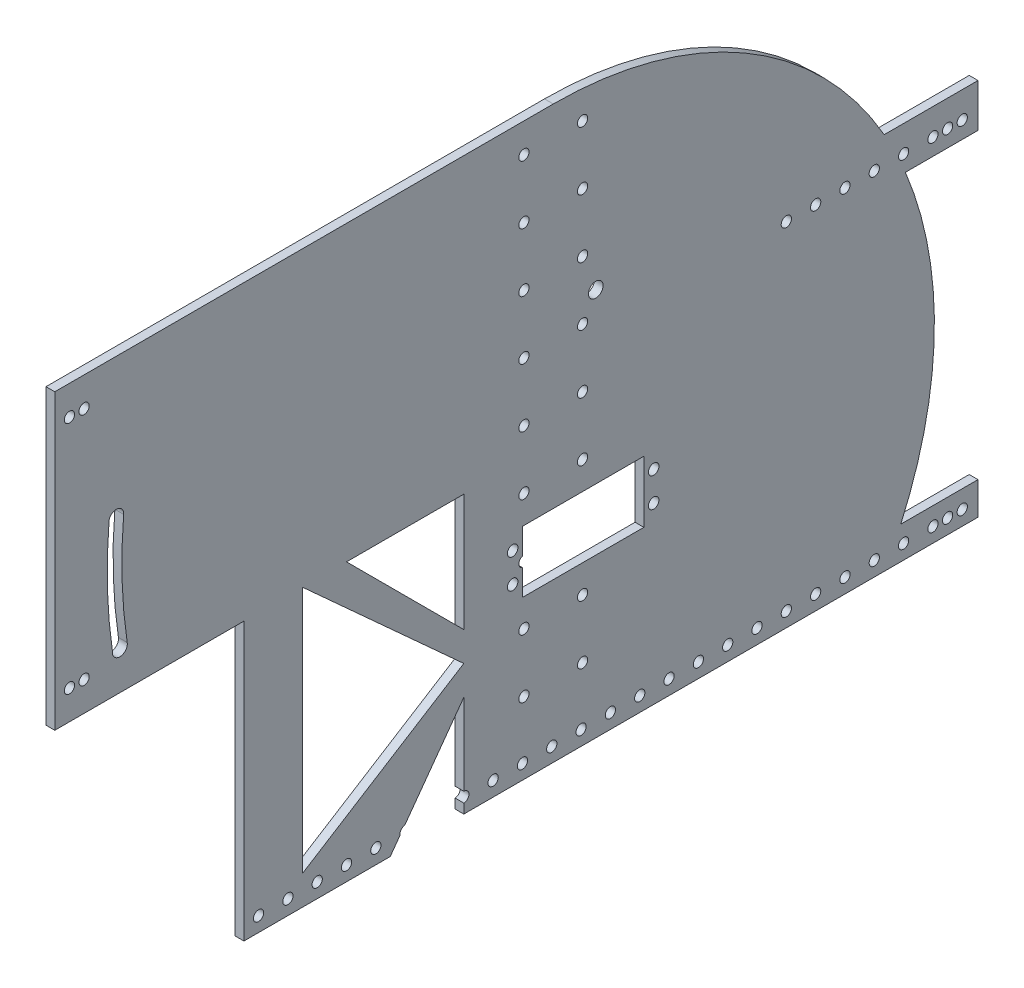
from build123d import *

# Parameters (mm, degrees)
SKETCH1_R           = 5
BOSS_EXTRUDE1_DEPTH = 3
SKETCH2_R           = 1.8
SKETCH2_W           = 41.4
SKETCH2_H           = 21
SERVOHOLE_DEPTH     = 215.030371677
SKETCH3_W           = 322.70302131
SKETCH3_H           = 65.5
CUT_EXTRUDE2_DEPTH  = 215.030371677
SKETCH4_W           = 64.5
SKETCH4_H           = 115
CUT_EXTRUDE5_DEPTH  = 215.030371677
SKETCH5_R           = 1.75
CUT_EXTRUDE6_DEPTH  = 10
LPATTERN1_COUNT     = 14
LPATTERN1_PITCH     = 10
LPATTERN2_COUNT     = 14
LPATTERN2_PITCH     = 10
SKETCH6_R           = 1.75
CUT_EXTRUDE7_DEPTH  = 10
BOSS_EXTRUDE2_START = -3
SKETCH7_R           = 1.75
BOSS_EXTRUDE2_DEPTH = 3
SKETCH8_R           = 2.5
CUT_EXTRUDE8_DEPTH  = 3
SKETCH9_R           = 1.75
CUT_EXTRUDE9_DEPTH  = 10
SKETCH10_R          = 1.75
CUT_EXTRUDE10_DEPTH = 10


with BuildPart() as part:
    # Sketch1 → Boss-Extrude1 (new body)
    with BuildSketch(Plane(origin=(0, 0, 0), x_dir=(0, 0, -1), z_dir=(1, 0, 0))):
        with BuildLine():
            Line((0, 130), (-170, 130))
            Line((-170, 130), (-170, 30))
            Line((-170, 30), (-126.491106407, 30))
            ThreePointArc((-126.491106407, 30), (80.622577483, -101.980390272), (0, 130))
        make_face()
        Circle(SKETCH1_R, mode=Mode.SUBTRACT)
    extrude(amount=BOSS_EXTRUDE1_DEPTH)

    # Sketch2 → ServoHole (cut, through all)
    with BuildSketch(Plane(origin=(3, 0, 0), x_dir=(0, 0, -1), z_dir=(1, 0, 0))):
        with Locations((-13.85, 5)):
            Circle(SKETCH2_R)
        with Locations((-13.85, -5)):
            Circle(SKETCH2_R)
        with Locations((34.25, 5)):
            Circle(SKETCH2_R)
        with Locations((34.25, -5)):
            Circle(SKETCH2_R)
        with Locations((10.2, 0)):
            Rectangle(SKETCH2_W, SKETCH2_H)
    extrude(amount=-SERVOHOLE_DEPTH, mode=Mode.SUBTRACT)

    # Sketch3 → Cut-Extrude2 (cut, through all)
    with BuildSketch(Plane(origin=(3, 0, 0), x_dir=(0, 0, -1), z_dir=(1, 0, 0))):
        with Locations((-37.404207891, -97.25)):
            Rectangle(SKETCH3_W, SKETCH3_H)
    extrude(amount=-CUT_EXTRUDE2_DEPTH, mode=Mode.SUBTRACT)

    # Sketch4 → Cut-Extrude5 (cut, through all)
    with BuildSketch(Plane(origin=(3, 0, 0), x_dir=(0, 0, -1), z_dir=(1, 0, 0))):
        with Locations((-137.75, -27.5)):
            Rectangle(SKETCH4_W, SKETCH4_H)
        Polygon((-30.5, 30), (-30.5, -10), (-70.5, 30), align=None)
        Polygon((-85.5, 30), (-30.5, -20), (-85.5, -54.5), align=None)
        Polygon((-30.5, -30), (-70.5, -85), (-30.5, -85), align=None)
    extrude(amount=-CUT_EXTRUDE5_DEPTH, mode=Mode.SUBTRACT)

    # Sketch5 → Cut-Extrude6 (cut)
    with BuildSketch(Plane(origin=(3, 0, 0), x_dir=(0, 0, -1), z_dir=(1, 0, 0))):
        with Locations((-20.5, -59.5)):
            Circle(SKETCH5_R)
    cut_extrude6 = extrude(amount=-CUT_EXTRUDE6_DEPTH, mode=Mode.SUBTRACT)

    # LPattern1: Cut-Extrude6 ×14
    with Locations(*[(0, 0, -i * LPATTERN1_PITCH) for i in range(1, LPATTERN1_COUNT)]):
        add(cut_extrude6, mode=Mode.SUBTRACT)

    # LPattern2: Cut-Extrude6 ×14
    with Locations(*[(0, 0, i * LPATTERN2_PITCH) for i in range(1, LPATTERN2_COUNT)]):
        add(cut_extrude6, mode=Mode.SUBTRACT)

    # Sketch6 → Cut-Extrude7 (cut)
    with BuildSketch(Plane(origin=(3, 0, 0), x_dir=(0, 0, -1), z_dir=(1, 0, 0))):
        with Locations((109.5, 55.5)):
            Circle(SKETCH6_R)
        with Locations((99.5, 55.5)):
            Circle(SKETCH6_R)
        with Locations((89.5, 55.5)):
            Circle(SKETCH6_R)
        with Locations((79.5, 55.5)):
            Circle(SKETCH6_R)
    extrude(amount=-CUT_EXTRUDE7_DEPTH, mode=Mode.SUBTRACT)

    # Sketch7 → Boss-Extrude2 (add)
    # profile 1 of 2: a face of its own
    with BuildSketch(Plane(origin=(3, 0, 0), x_dir=(0, 0, -1), z_dir=(1, 0, 0)).offset(BOSS_EXTRUDE2_START)):
        with BuildLine():
            Line((112.870501018, -64.5), (144.870501018, -64.5))
            Line((144.870501018, -64.5), (144.870501018, -53.383029617))
            Line((144.870501018, -53.383029617), (118.533759533, -53.383029617))
            ThreePointArc((118.533759533, -53.383029617), (115.835571859, -59.009493238), (112.870501018, -64.5))
        make_face()
        with Locations((119.5, -59.5)):
            Circle(SKETCH7_R, mode=Mode.SUBTRACT)
        with Locations((129.5, -59.5)):
            Circle(SKETCH7_R, mode=Mode.SUBTRACT)
        with Locations((139.5, -59.5)):
            Circle(SKETCH7_R, mode=Mode.SUBTRACT)
        with Locations((134.5, -59.5)):
            Circle(SKETCH7_R, mode=Mode.SUBTRACT)
    # profile 2 of 2: a face of its own
    with BuildSketch(Plane(origin=(3, 0, 0), x_dir=(0, 0, -1), z_dir=(1, 0, 0)).offset(BOSS_EXTRUDE2_START)):
        with BuildLine():
            Line((112.870501018, 64.5), (144.870501018, 64.5))
            Line((144.870501018, 64.5), (144.870501018, 49.754581271))
            Line((144.870501018, 49.754581271), (120.101963525, 49.754581271))
            ThreePointArc((120.101963525, 49.754581271), (116.719317819, 57.241600675), (112.870501018, 64.5))
        make_face()
        with Locations((119.5, 55.5)):
            Circle(SKETCH7_R, mode=Mode.SUBTRACT)
        with Locations((129.5, 55.5)):
            Circle(SKETCH7_R, mode=Mode.SUBTRACT)
        with Locations((139.5, 55.5)):
            Circle(SKETCH7_R, mode=Mode.SUBTRACT)
        with Locations((134.5, 55.5)):
            Circle(SKETCH7_R, mode=Mode.SUBTRACT)
    extrude(amount=BOSS_EXTRUDE2_DEPTH)

    # Sketch8 → Cut-Extrude8 (cut)
    with BuildSketch(Plane.ZY):
        with Locations((-14.5, 67.89)):
            Circle(SKETCH8_R)
        with BuildLine():
            ThreePointArc((146.515496678, 82.033656727), (147.054309045, 62.76765435), (145.296085194, 43.574483293))
            ThreePointArc((145.296085194, 43.574483293), (147.823984799, 40.632816994), (150.351884405, 43.574483293))
            ThreePointArc((150.351884405, 43.574483293), (152.056813165, 62.769830784), (151.534168528, 82.033656727))
            ThreePointArc((151.534168528, 82.033656727), (149.024832603, 84.773075908), (146.515496678, 82.033656727))
        make_face()
    extrude(amount=-CUT_EXTRUDE8_DEPTH, mode=Mode.SUBTRACT)

    # Sketch9 → Cut-Extrude9 (cut)
    with BuildSketch(Plane.ZY):
        with Locations((160, 40)):
            Circle(SKETCH9_R)
        with Locations((160, 120)):
            Circle(SKETCH9_R)
        with Locations((165, 40)):
            Circle(SKETCH9_R)
        with Locations((165, 120)):
            Circle(SKETCH9_R)
    extrude(amount=-CUT_EXTRUDE9_DEPTH, mode=Mode.SUBTRACT)

    # Sketch10 → Cut-Extrude10 (cut)
    with BuildSketch(Plane.ZY):
        with Locations((10, 120)):
            Circle(SKETCH10_R)
        with Locations((10, 100)):
            Circle(SKETCH10_R)
        with Locations((10, 80)):
            Circle(SKETCH10_R)
        with Locations((10, 60)):
            Circle(SKETCH10_R)
        with Locations((10, 40)):
            Circle(SKETCH10_R)
        with Locations((10, 20)):
            Circle(SKETCH10_R)
        with Locations((10, 0)):
            Circle(SKETCH10_R)
        with Locations((10, -20)):
            Circle(SKETCH10_R)
        with Locations((10, -40)):
            Circle(SKETCH10_R)
        with Locations((-10, 20)):
            Circle(SKETCH10_R)
        with Locations((-10, -20)):
            Circle(SKETCH10_R)
        with Locations((-10, -40)):
            Circle(SKETCH10_R)
        with Locations((-10, 40)):
            Circle(SKETCH10_R)
        with Locations((-10, 60)):
            Circle(SKETCH10_R)
        with Locations((-10, 80)):
            Circle(SKETCH10_R)
        with Locations((-10, 100)):
            Circle(SKETCH10_R)
        with Locations((-10, 120)):
            Circle(SKETCH10_R)
    extrude(amount=-CUT_EXTRUDE10_DEPTH, mode=Mode.SUBTRACT)


solid = part.part
